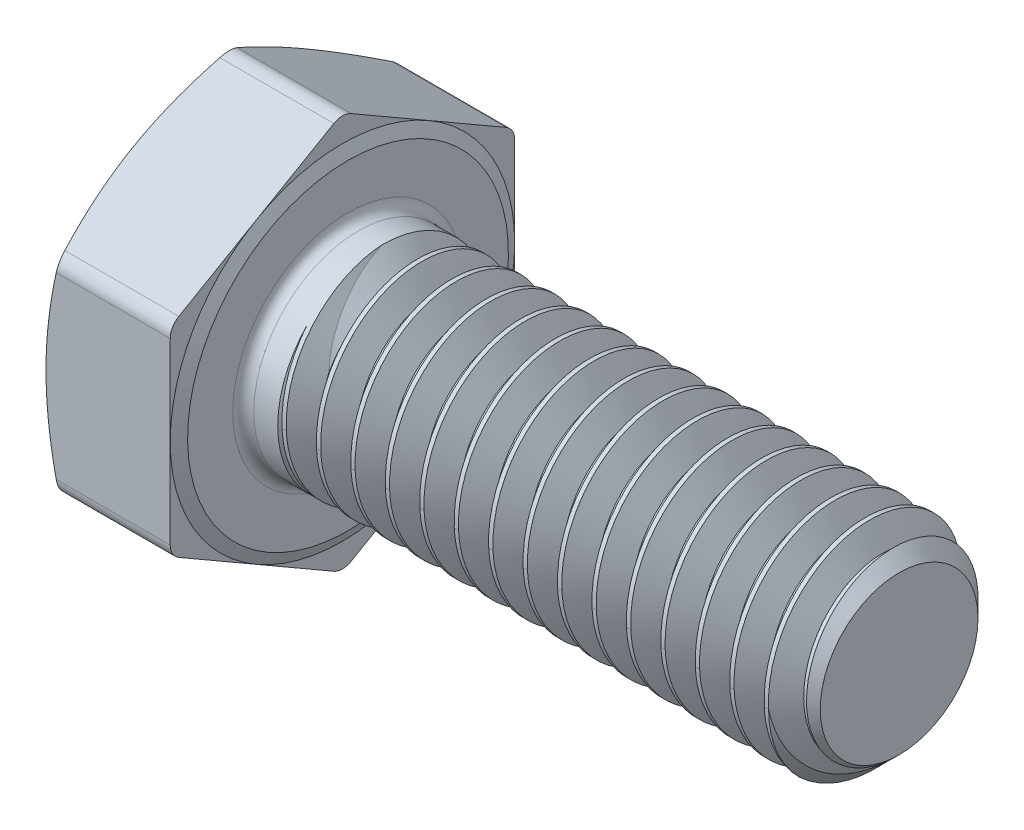
from build123d import *

# Parameters (mm, degrees)
SKETCH2_R                = 2.413
BOSS_EXTRUDE1_DEPTH      = 12.7
BOSS_EXTRUDE2_DEPTH      = 3.175
SKETCH5_OUTSIDE_W        = 27.55
SKETCH5_OUTSIDE_H        = 28.778
SKETCH5_OUTSIDE_R        = 3.571875
CUT_EXTRUDE1_DEPTH       = 3.175
CUT_EXTRUDE1_DRAFT       = -65
BOSS_EXTRUDE5_DEPTH      = 0.0635
FILLET5_R                = 0.0635
CIRPATTERN1_COUNT        = 6
FILLET5_OF_CIRPATTERN1_R = 0.0635
FILLET7_R                = 0.396875
CHAMFER1_SIZE            = 0.5953125
FILLET4_R                = 0.2413
CUT_SWEEP1_PITCH         = 0.79375
CUT_SWEEP1_TO            = 11.90625


with BuildPart() as part:
    # Sketch2 → Boss-Extrude1 (new body)
    with BuildSketch(Plane(origin=(0, 0, 0), x_dir=(0, 0, -1), z_dir=(1, 0, 0))):
        Circle(SKETCH2_R)
    extrude(amount=BOSS_EXTRUDE1_DEPTH)

    # Sketch3 → Boss-Extrude2 (add)
    with BuildSketch(Plane.ZY):
        Polygon((0, 4.582717762), (-3.96875, 2.291358881), (-3.96875, -2.291358881), (0, -4.582717762), (3.96875, -2.291358881), (3.96875, 2.291358881), align=None)
    extrude(amount=BOSS_EXTRUDE2_DEPTH)


with BuildPart() as cut_extrude1_tool:
    # Sketch5 outside → Cut-Extrude1 (with draft: the straight prism first)
    with BuildSketch(Plane.ZY.offset(3.175)):
        Rectangle(SKETCH5_OUTSIDE_W, SKETCH5_OUTSIDE_H)
        Circle(SKETCH5_OUTSIDE_R, mode=Mode.SUBTRACT)
    extrude(amount=-CUT_EXTRUDE1_DEPTH)
    # Cut-Extrude1: the draft: its side faces are tilted about the plane it starts from
    cut_extrude1_sides = [cut_extrude1_tool.faces().sort_by_distance(p)[0] for p in [
        (-1.5875, -14.389, 0),
        (-1.5875, 0, 13.775),
        (-1.5875, 14.389, 0),
        (-1.5875, 0, -13.775),
        (-1.5875, 0, -3.571875),
    ]]
    draft(cut_extrude1_sides, Plane.ZY.offset(3.175), CUT_EXTRUDE1_DRAFT)


with BuildPart() as part_1:
    add(part.part)

    # Cut-Extrude1: cut by cut_extrude1_tool
    add(cut_extrude1_tool.part, mode=Mode.SUBTRACT)

    # Sketch11 → Boss-Extrude5 (add)
    with BuildSketch(Plane.ZY.offset(3.175)):
        with BuildLine():
            Line((0.15875, 2.8178125), (0.15875, 1.74625))
            ThreePointArc((0.15875, 1.74625), (0, 1.5875), (-0.15875, 1.74625))
            Line((-0.15875, 1.74625), (-0.15875, 2.8178125))
            ThreePointArc((-0.15875, 2.8178125), (0, 2.9765625), (0.15875, 2.8178125))
        make_face()
    boss_extrude5 = extrude(amount=BOSS_EXTRUDE5_DEPTH)

    # Fillet5
    fillet5_edges = [part_1.edges().sort_by_distance(p)[0] for p in [
        (-3.2385, 2.28203125, 0.15875),
        (-3.2385, 1.5875, 0),
        (-3.2385, 2.28203125, -0.15875),
        (-3.2385, 2.9765625, 0),
    ]]
    fillet(fillet5_edges, radius=FILLET5_R - 0.0001)  # a hair under: the kernel refuses the full size

    # CirPattern1: Boss-Extrude5 ×6 about axis
    cirpattern1_axis = Axis((0, 0, 0), (1, 0, 0))
    for i in range(1, CIRPATTERN1_COUNT):
        add(boss_extrude5.rotate(cirpattern1_axis, i * 360 / CIRPATTERN1_COUNT))

    # Fillet5 of CirPattern1
    fillet5_of_cirpattern1_edges = [part_1.edges().sort_by_distance(p)[0] for p in [
        (-3.2385, 1.003534092, 2.055672035),
        (-3.2385, 0.79375, 1.374815329),
        (-3.2385, 1.278497158, 1.896922035),
        (-3.2385, 1.48828125, 2.577778741),
        (-3.2385, -1.278497158, 1.896922035),
        (-3.2385, -0.79375, 1.374815329),
        (-3.2385, -1.003534092, 2.055672035),
        (-3.2385, -1.48828125, 2.577778741),
        (-3.2385, -2.28203125, -0.15875),
        (-3.2385, -1.5875, 0),
        (-3.2385, -2.28203125, 0.15875),
        (-3.2385, -2.9765625, 0),
        (-3.2385, -1.003534092, -2.055672035),
        (-3.2385, -0.79375, -1.374815329),
        (-3.2385, -1.278497158, -1.896922035),
        (-3.2385, -1.48828125, -2.577778741),
        (-3.2385, 1.278497158, -1.896922035),
        (-3.2385, 0.79375, -1.374815329),
        (-3.2385, 1.003534092, -2.055672035),
        (-3.2385, 1.48828125, -2.577778741),
    ]]
    fillet(fillet5_of_cirpattern1_edges, radius=FILLET5_OF_CIRPATTERN1_R - 0.0001)  # a hair under: the kernel refuses the full size

    # Fillet7
    fillet7_edges = [part_1.edges().sort_by_distance(p)[0] for p in [
        (-1.35181814, -4.582717762, 0),
        (-1.35181814, -2.291358881, -3.96875),
        (-1.35181814, 2.291358881, -3.96875),
        (-1.35181814, 4.582717762, 0),
        (-1.35181814, -2.291358881, 3.96875),
        (-1.35181814, 2.291358881, 3.96875),
    ]]
    fillet(fillet7_edges, radius=FILLET7_R)

    # Chamfer1
    chamfer1_edges = [part_1.edges().sort_by_distance(p)[0] for p in [
        (12.7, 0, 2.413),
    ]]
    chamfer(chamfer1_edges, length=CHAMFER1_SIZE)

    # Sketch15 → Cut-Revolve1 (revolve, cut)
    with BuildSketch(Plane.XY, mode=Mode.PRIVATE) as cut_revolve1_sk:
        Polygon((0, 3.696397621), (-0.127, 3.96875), (-0.127, 4.582717762), (0, 4.582717762), align=None)
    revolve(cut_revolve1_sk.sketch.rotate(Axis((0, 0, 0), (-1, 0, 0)), 210), axis=Axis((0, 0, 0), (-1, 0, 0)), mode=Mode.SUBTRACT)

    # Fillet4
    fillet4_edges = [part_1.edges().sort_by_distance(p)[0] for p in [
        (0, 0, 2.413),
    ]]
    fillet(fillet4_edges, radius=FILLET4_R)


with BuildPart() as body_2:
    # Split1: the piece on the far side of the plane
    add(part_1.part)
    split(bisect_by=Plane(origin=(0.79375, 0, 0), x_dir=(0, 0, 1), z_dir=(1, 0, 0)), keep=Keep.BOTTOM)


with BuildPart() as part_2:
    add(part_1.part)

    # Split1
    split(bisect_by=Plane(origin=(0.79375, 0, 0), x_dir=(0, 0, 1), z_dir=(1, 0, 0)), keep=Keep.TOP)

    # Cut-Sweep1: arcs per turn and ends read off the stored shape
    # Cut-Sweep1: the profile of Sketch13 profile screwed along a right-hand helix through 17 turns, 8 arcs to a turn; built about Z, then put on its axis
    cut_sweep1_z = Axis((0, 0, 0), (0, 0, 1))
    cut_sweep1_corners = [(2.4133, 0, 0.000173205), (2.4133, 0, -0.694704455), (1.897444252, 0, -0.396875), (1.897444252, 0, -0.29765625)]
    with BuildLine(mode=Mode.PRIVATE) as cut_sweep1_profile:
        Line(cut_sweep1_corners[0], cut_sweep1_corners[1])
        Line(cut_sweep1_corners[1], cut_sweep1_corners[2])
        Line(cut_sweep1_corners[2], cut_sweep1_corners[3])
        Line(cut_sweep1_corners[3], cut_sweep1_corners[0])
    cut_sweep1_cap = Face(cut_sweep1_profile.wire())
    cut_sweep1_turn_angles = [0, 22.5, 45, 67.5, 90, 112.5, 135, 157.5, 180, 202.5, 225, 247.5, 270, 292.5, 315, 337.5, 360]
    cut_sweep1_turn_weights = [1, 0.9238795325112867, 1, 0.9238795325112867, 1, 0.9238795325112867, 1, 0.9238795325112867, 1, 0.9238795325112867, 1, 0.9238795325112867, 1, 0.9238795325112867, 1, 0.9238795325112867, 1]
    cut_sweep1_turn_rails = [Edge.make_bspline([Vector(p[0], p[1], 0).rotate(cut_sweep1_z, cut_sweep1_turn_angles[k]) / cut_sweep1_turn_weights[k] + Vector(0, 0, p[2] + CUT_SWEEP1_PITCH * cut_sweep1_turn_angles[k] / 360) for k in range(17)], [0, 0, 0, 1, 1, 2, 2, 3, 3, 4, 4, 5, 5, 6, 6, 7, 7, 8, 8, 8], 2, cut_sweep1_turn_weights) for p in cut_sweep1_corners]
    cut_sweep1_turn_sides = [Face.make_surface_from_curves(cut_sweep1_turn_rails[p[0]], cut_sweep1_turn_rails[p[1]]) for p in [(0, 1), (1, 2), (2, 3), (3, 0)]]
    cut_sweep1 = Plane(origin=(12.7, 0, 0), x_dir=(0, 1, 0), z_dir=(-1, 0, 0)) * split(Solid(Shell([*[p.moved(Location((0, 0, CUT_SWEEP1_PITCH * i))) for i in range(17) for p in cut_sweep1_turn_sides], cut_sweep1_cap, cut_sweep1_cap.rotate(cut_sweep1_z, 6120).moved(Location((0, 0, CUT_SWEEP1_PITCH * 6120 / 360)))])), bisect_by=Plane.XY.offset(CUT_SWEEP1_TO), keep=Keep.BOTTOM, mode=Mode.PRIVATE)
    add(cut_sweep1, mode=Mode.SUBTRACT)

    add(body_2.part)  # Boss-Extrude4 merges body 2
    # Boss-Extrude4: read off the stored shape, not the designer's step
    # Boss-Extrude4 outline → Boss-Extrude4 (revolve)
    with BuildSketch(Plane.YX):
        Polygon((2.413, 0.79375), (1.897439704, 1.226356454), (1.897439704, 0.79375), align=None)
    revolve(axis=Axis((0, 0, 0), (1, 0, 0)))


solid = part_2.part
